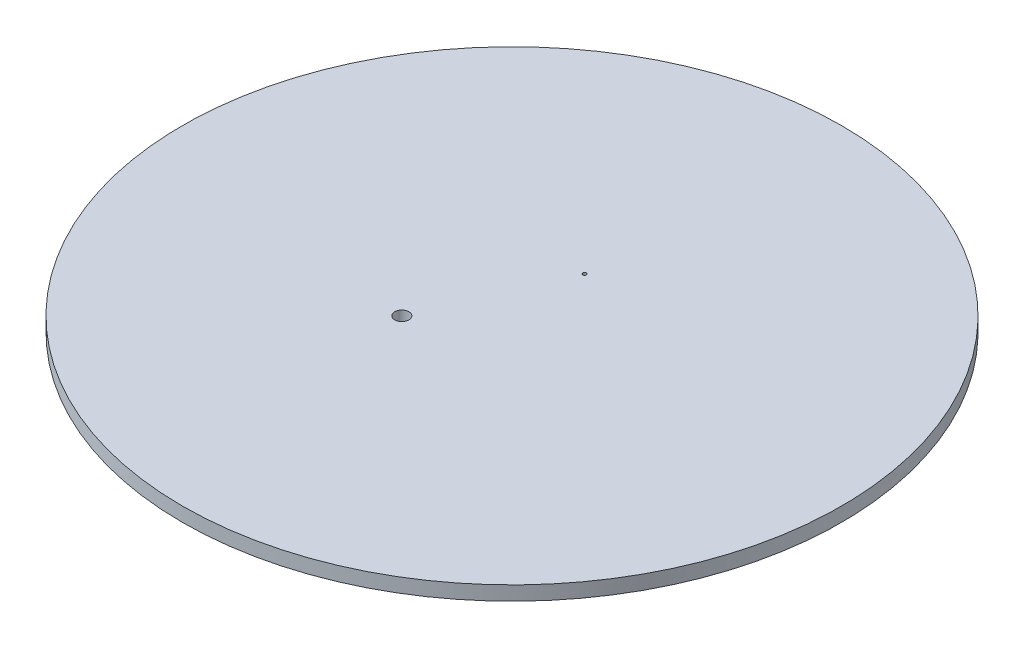
from build123d import *

# Parameters (mm, degrees)
SKETCH1_R               = 46.53
BOSS_EXTRUDE1_DEPTH     = 2
CUT_EXTRUDE1_DEPTH      = 66.833743627
CUT_EXTRUDE1_DEPTH_BACK = 66.833743627
SKETCH2_R               = 0.25
CUT_EXTRUDE2_DEPTH      = 66.833743627
CUT_EXTRUDE2_DEPTH_BACK = 66.833743627
SKETCH3_R               = 1


with BuildPart() as part:
    # Sketch1 → Boss-Extrude1 (new body)
    with BuildSketch(Plane(origin=(0, 0, 0), x_dir=(1, 0, 0), z_dir=(0, 1, 0))):
        Circle(SKETCH1_R)
    extrude(amount=BOSS_EXTRUDE1_DEPTH)

    # Sketch2 → Cut-Extrude1 (cut, two sides: drawn at the far end of the back side and taken through both)
    with BuildSketch(Plane(origin=(0, 2, 0), x_dir=(1, 0, 0), z_dir=(0, 1, 0)).offset(-CUT_EXTRUDE1_DEPTH_BACK)):
        with Locations((0, 10.25)):
            Circle(SKETCH2_R)
    extrude(amount=CUT_EXTRUDE1_DEPTH + CUT_EXTRUDE1_DEPTH_BACK, mode=Mode.SUBTRACT)

    # Sketch3 → Cut-Extrude2 (cut, two sides: drawn at the far end of the back side and taken through both)
    with BuildSketch(Plane(origin=(0, 2, 0), x_dir=(1, 0, 0), z_dir=(0, 1, 0)).offset(-CUT_EXTRUDE2_DEPTH_BACK)):
        with Locations((-7.778174593, -7.778174593)):
            Circle(SKETCH3_R)
    extrude(amount=CUT_EXTRUDE2_DEPTH + CUT_EXTRUDE2_DEPTH_BACK, mode=Mode.SUBTRACT)


solid = part.part
